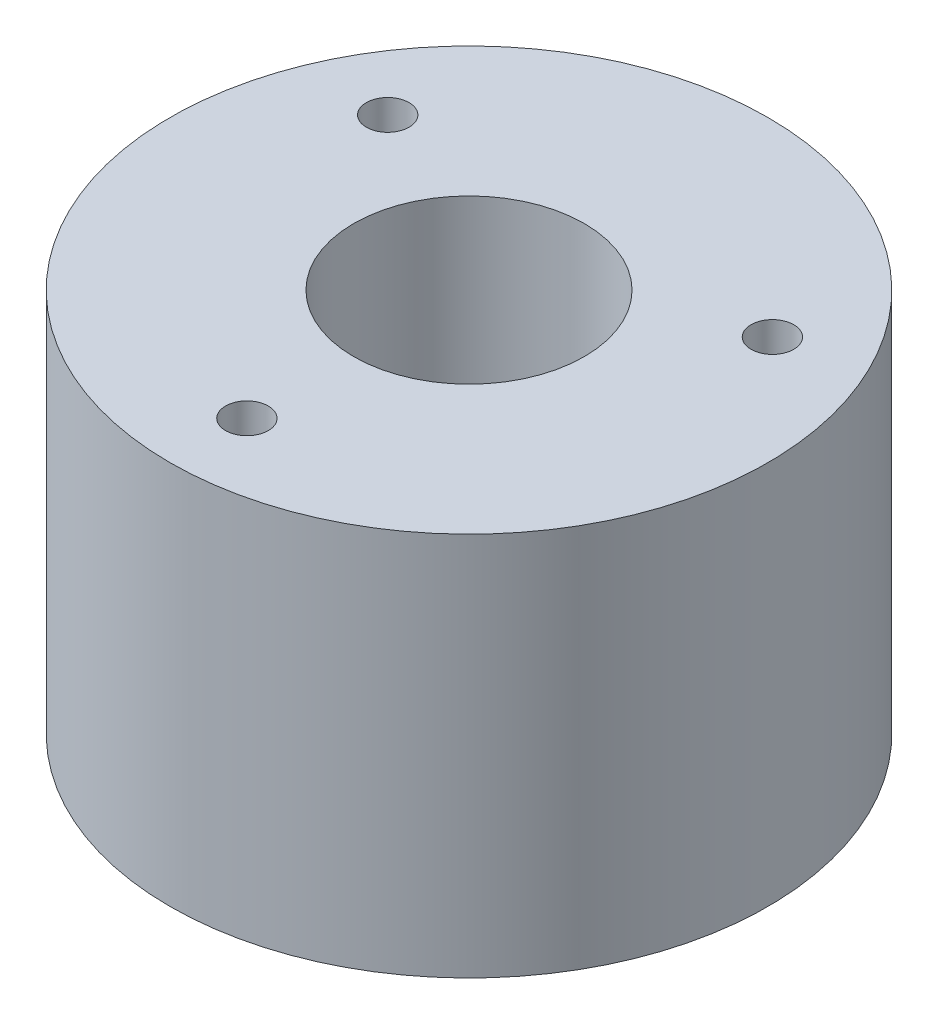
from build123d import *

# Parameters (mm, degrees)
SKETCH1_R           = 22.225
SKETCH1_R_2         = 8.5725
BOSS_EXTRUDE1_DEPTH = 28.575
SKETCH2_R           = 8.5725
CUT_EXTRUDE1_DEPTH  = 9.921875
FILLET1_R           = 3.175
SKETCH3_R           = 1.5875
CUT_EXTRUDE2_DEPTH  = 43.478604909


with BuildPart() as part:
    # Sketch1 → Boss-Extrude1 (new body)
    with BuildSketch(Plane(origin=(0, 0, 0), x_dir=(1, 0, 0), z_dir=(0, 1, 0))):
        Circle(SKETCH1_R)
        Circle(SKETCH1_R_2, mode=Mode.SUBTRACT)
    extrude(amount=BOSS_EXTRUDE1_DEPTH)

    # Sketch2 → Cut-Extrude1 (cut)
    with BuildSketch(Plane.XZ):
        with BuildLine():
            Line((5.334, 11.988389665), (-5.334, 11.988389665))
            ThreePointArc((-5.334, 11.988389665), (-7.71525, 13.363204993), (-7.71525, 10.613574336))
            Line((-7.71525, 10.613574336), (-13.04925, 1.374815329))
            ThreePointArc((-13.04925, 1.374815329), (-15.4305, 0), (-13.04925, -1.374815329))
            Line((-13.04925, -1.374815329), (-7.71525, -10.613574336))
            ThreePointArc((-7.71525, -10.613574336), (-7.71525, -13.363204993), (-5.334, -11.988389665))
            Line((-5.334, -11.988389665), (5.334, -11.988389665))
            ThreePointArc((5.334, -11.988389665), (7.71525, -13.363204993), (7.71525, -10.613574336))
            Line((7.71525, -10.613574336), (13.04925, -1.374815329))
            ThreePointArc((13.04925, -1.374815329), (15.4305, 0), (13.04925, 1.374815329))
            Line((13.04925, 1.374815329), (7.71525, 10.613574336))
            ThreePointArc((7.71525, 10.613574336), (7.71525, 13.363204993), (5.334, 11.988389665))
        make_face()
        Circle(SKETCH2_R, mode=Mode.SUBTRACT)
    extrude(amount=-CUT_EXTRUDE1_DEPTH, mode=Mode.SUBTRACT)

    # Fillet1
    fillet1_edges = [part.edges().sort_by_distance(p)[0] for p in [
        (-13.04925, 4.9609375, -1.374815329),
        (-7.71525, 4.9609375, -10.613574336),
        (-5.334, 4.9609375, -11.988389665),
        (5.334, 4.9609375, -11.988389665),
        (7.71525, 4.9609375, -10.613574336),
        (13.04925, 4.9609375, -1.374815329),
        (13.04925, 4.9609375, 1.374815329),
        (7.71525, 4.9609375, 10.613574336),
        (5.334, 4.9609375, 11.988389665),
        (-5.334, 4.9609375, 11.988389665),
        (-7.71525, 4.9609375, 10.613574336),
        (-13.04925, 4.9609375, 1.374815329),
    ]]
    fillet(fillet1_edges, radius=FILLET1_R)

    # Sketch3 → Cut-Extrude2 (cut, through all)
    with BuildSketch(Plane.XZ):
        with Locations((0, 16.51)):
            Circle(SKETCH3_R)
        with Locations((14.298079416, -8.255)):
            Circle(SKETCH3_R)
        with Locations((-14.298079416, -8.255)):
            Circle(SKETCH3_R)
    extrude(amount=-CUT_EXTRUDE2_DEPTH, mode=Mode.SUBTRACT)


solid = part.part
